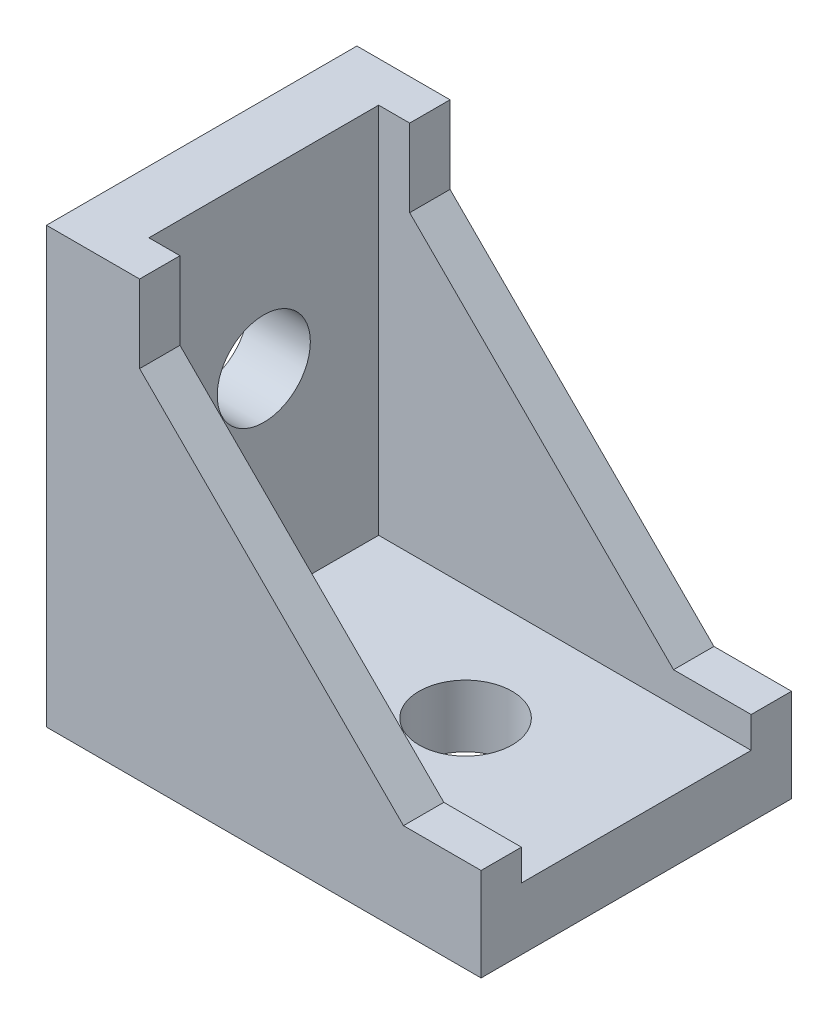
from build123d import *

# Parameters (mm, degrees)
EXTRUDE_1_DEPTH     = 20
SKETCH_2_R          = 3
CUT_EXTRUDE_1_DEPTH = 42.952353927
SKETCH_3_R          = 3
CUT_EXTRUDE_2_DEPTH = 42.952353927
SKETCH_4_W          = 2
SKETCH_4_H          = 6
EXTRUDE_1_2_DEPTH   = 1.5
SKETCH_5_W          = 4
SKETCH_5_H          = 6
CUT_EXTRUDE_3_DEPTH = 1.5
SKETCH_6_W          = 6
SKETCH_6_H          = 2
EXTRUDE_2_DEPTH     = 1.5
SKETCH_7_W          = 6
SKETCH_7_H          = 4
CUT_EXTRUDE_4_DEPTH = 1.5
SKETCH_8_W          = 6
SKETCH_8_H          = 2
EXTRUDE_3_DEPTH     = 1.5
SKETCH_10_W         = 6
SKETCH_10_H         = 2
CUT_EXTRUDE_6_DEPTH = 1.5
SKETCH_11_W         = 2
SKETCH_11_H         = 6
EXTRUDE_4_DEPTH     = 1.5
SKETCH_12_W         = 2
SKETCH_12_H         = 6
CUT_EXTRUDE_7_DEPTH = 1.5
RIB_1_DEPTH         = 2.6
RIB_START           = -2.6
RIB_2_DEPTH         = 2.6


# Read off the part's stored shape, not the designer's step: 筋1, 筋2
with BuildPart() as part:
    # 草图1 → Extrude 1 (new body)
    with BuildSketch(Plane.XY):
        Polygon((28, 0), (0, 0), (0, 28), (4, 28), (4, 4), (28, 4), align=None)
    extrude(amount=EXTRUDE_1_DEPTH)

    # 草图2 → 切除-拉伸1 (cut, through all)
    with BuildSketch(Plane(origin=(0, 4, 0), x_dir=(1, 0, 0), z_dir=(0, 1, 0))):
        with Locations(Location((17, -10, 0), (0, 0, 180))):
            Circle(SKETCH_2_R)
    extrude(amount=-CUT_EXTRUDE_1_DEPTH, mode=Mode.SUBTRACT)

    # 草图3 → 切除-拉伸2 (cut, through all)
    with BuildSketch(Plane(origin=(4, 0, 0), x_dir=(0, 0, -1), z_dir=(1, 0, 0))):
        with Locations((-10, 17)):
            Circle(SKETCH_3_R)
    extrude(amount=-CUT_EXTRUDE_2_DEPTH, mode=Mode.SUBTRACT)

    # 草图4 → Extrude 1 2 (add)
    with BuildSketch(Plane.XZ):
        with Locations((3, 10)):
            Rectangle(SKETCH_4_W, SKETCH_4_H)
    extrude(amount=EXTRUDE_1_2_DEPTH)

    # 草图5 → 切除-拉伸3 (cut)
    with BuildSketch(Plane.XZ):
        with Locations((6, 10)):
            Rectangle(SKETCH_5_W, SKETCH_5_H)
    extrude(amount=-CUT_EXTRUDE_3_DEPTH, mode=Mode.SUBTRACT)

    # 草图6 → 凸台-拉伸2 (add)
    with BuildSketch(Plane.ZY):
        with Locations((10, 3)):
            Rectangle(SKETCH_6_W, SKETCH_6_H)
    extrude(amount=EXTRUDE_2_DEPTH)

    # 草图7 → 切除-拉伸4 (cut)
    with BuildSketch(Plane.ZY):
        with Locations((10, 6)):
            Rectangle(SKETCH_7_W, SKETCH_7_H)
    extrude(amount=-CUT_EXTRUDE_4_DEPTH, mode=Mode.SUBTRACT)

    # 草图8 → 凸台-拉伸3 (add)
    with BuildSketch(Plane.ZY):
        with Locations((10, 25)):
            Rectangle(SKETCH_8_W, SKETCH_8_H)
    extrude(amount=EXTRUDE_3_DEPTH)

    # 草图10 → 切除-拉伸6 (cut)
    with BuildSketch(Plane.ZY):
        with Locations((10, 23)):
            Rectangle(SKETCH_10_W, SKETCH_10_H)
    extrude(amount=-CUT_EXTRUDE_6_DEPTH, mode=Mode.SUBTRACT)

    # 草图11 → 凸台-拉伸4 (add)
    with BuildSketch(Plane.XZ):
        with Locations((25, 10)):
            Rectangle(SKETCH_11_W, SKETCH_11_H)
    extrude(amount=EXTRUDE_4_DEPTH)

    # 草图12 → 切除-拉伸7 (cut)
    with BuildSketch(Plane.XZ):
        with Locations((23, 10)):
            Rectangle(SKETCH_12_W, SKETCH_12_H)
    extrude(amount=-CUT_EXTRUDE_7_DEPTH, mode=Mode.SUBTRACT)

    # 筋1 outline → 筋1 (add)
    with BuildSketch(Plane.XY):
        Polygon((6, 23), (6, 28), (4, 28), (4, 4), (28, 4), (28, 6), (23, 6), align=None)
    extrude(amount=RIB_1_DEPTH)

    # 筋2 outline → 筋2 (add)
    with BuildSketch(Plane.XY.offset(20).offset(RIB_START)):
        Polygon((6, 23), (6, 28), (4, 28), (4, 4), (28, 4), (28, 6), (23, 6), align=None)
    extrude(amount=RIB_2_DEPTH)


solid = part.part
